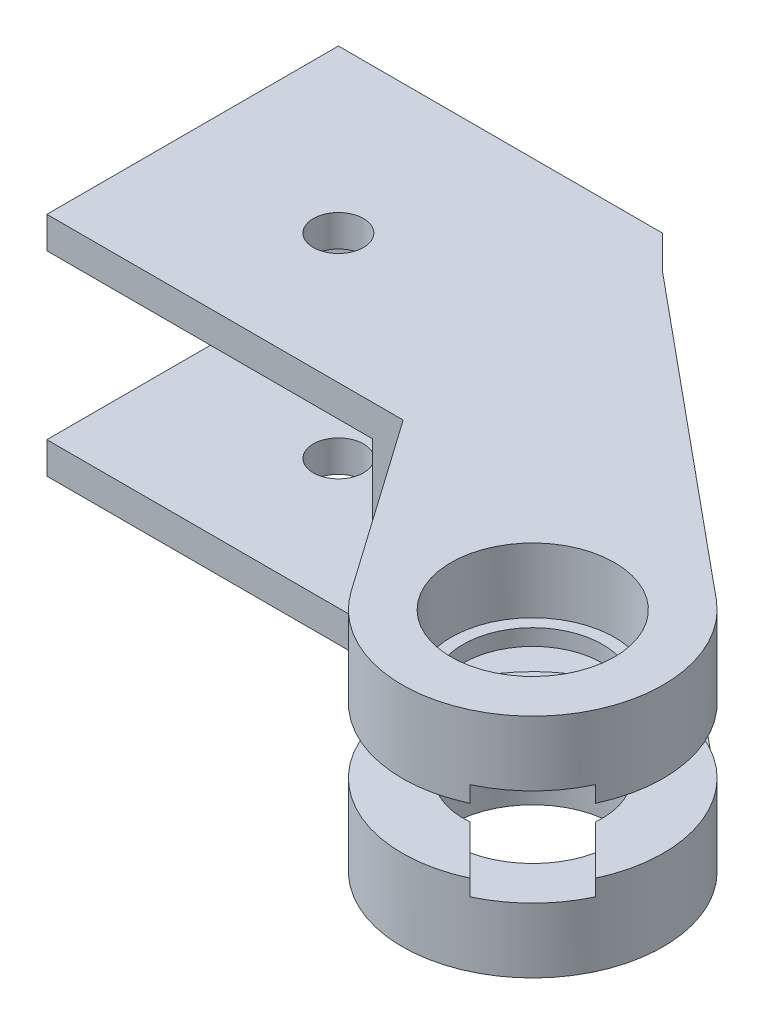
from build123d import *
from build123d.topology import SkipClean

# Parameters (mm, degrees)
SKETCH1_W           = 12
SKETCH1_H           = 16
BOSS_EXTRUDE1_DEPTH = 7
SKETCH4_W           = 16
SKETCH4_H           = 10.1
CUT_EXTRUDE1_DEPTH  = 10.1
SKETCH5_R           = 5.05
BOSS_EXTRUDE2_DEPTH = 4
BOSS_EXTRUDE3_DEPTH = 1
BOSS_EXTRUDE5_DEPTH = 6
SKETCH9_W           = 16
SKETCH9_H           = 1.95
BOSS_EXTRUDE6_DEPTH = 10
SKETCH10_W          = 22
SKETCH10_H          = 14
BOSS_EXTRUDE7_DEPTH = 2
CUT_EXTRUDE2_START  = -14
SKETCH7_R           = 1.55
CUT_EXTRUDE2_DEPTH  = 14
CHAMFER1_SIZE       = 2
SKETCH11_W          = 20.1
SKETCH11_H          = 10.1
CUT_EXTRUDE3_DEPTH  = 0.1


with BuildPart() as part:
    # Sketch1 → Boss-Extrude1 (new, symmetric)
    with BuildSketch(Plane(origin=(0, 0, 0), x_dir=(1, 0, 0), z_dir=(0, 1, 0))):
        with Locations((-6, 0)):
            Rectangle(SKETCH1_W, SKETCH1_H)
    extrude(amount=BOSS_EXTRUDE1_DEPTH, both=True)

    # Sketch4 → Cut-Extrude1 (cut)
    with BuildSketch(Plane.ZY.offset(12)):
        Rectangle(SKETCH4_W, SKETCH4_H)
    extrude(amount=-CUT_EXTRUDE1_DEPTH, mode=Mode.SUBTRACT)

    # Sketch5 → Boss-Extrude2 (add)
    with BuildSketch(Plane.XZ.offset(7)):
        with BuildLine():
            Line((0, 8), (7.55203, 18.76523))
            ThreePointArc((7.55203, 18.76523), (19.604366, 20.055387), (19.272474, 7.938739))
            Line((19.272474, 7.938739), (0, -8))
            Line((0, -8), (0, 8))
        make_face()
        with Locations(Location((14.142136, 14.142136, 0), (0, 0, 270))):
            Circle(SKETCH5_R, mode=Mode.SUBTRACT)
    boss_extrude2 = extrude(amount=-BOSS_EXTRUDE2_DEPTH)

    # Mirror1: Boss-Extrude2 across plane
    add(boss_extrude2.mirror(Plane(origin=(0, 0, 0), x_dir=(0, 0, 1), z_dir=(0, -1, 0))))

    # Sketch6 → Boss-Extrude3 (add)
    with SkipClean():  # the faces are left unmerged after this step: merging them gives an invalid solid
        with BuildSketch(Plane(origin=(0, -3, 0), x_dir=(1, 0, 0), z_dir=(0, 1, 0))):
            with BuildLine():
                Line((14.535059, -18.424146), (17.547358, -21.436446))
                ThreePointArc((17.547358, -21.436446), (8.449926, -8.449926), (21.436446, -17.547358))
                Line((21.436446, -17.547358), (18.424146, -14.535059))
                ThreePointArc((18.424146, -14.535059), (11.101576, -11.101576), (14.535059, -18.424146))
            make_face()
        boss_extrude3 = extrude(amount=BOSS_EXTRUDE3_DEPTH)

    # Mirror2: Boss-Extrude3 across plane
    with SkipClean():  # the faces are left unmerged after this step: merging them gives an invalid solid
        add(boss_extrude3.mirror(Plane(origin=(0, 0, 0), x_dir=(0, 0, 1), z_dir=(0, -1, 0))))

    # Sketch8 → Boss-Extrude5 (add)
    with SkipClean():  # the faces are left unmerged after this step: merging them gives an invalid solid
        with BuildSketch(Plane.XZ.offset(-3)):
            Polygon((13.107608, 2.840266), (0, -8), (0, 8), align=None)
        extrude(amount=BOSS_EXTRUDE5_DEPTH)

    # Sketch9 → Boss-Extrude6 (add)
    with SkipClean():  # the faces are left unmerged after this step: merging them gives an invalid solid
        with BuildSketch(Plane.ZY.offset(12)):
            with Locations((0, 6.025)):
                Rectangle(SKETCH9_W, SKETCH9_H)
            with Locations((0, -6.025)):
                Rectangle(SKETCH9_W, SKETCH9_H)
        extrude(amount=BOSS_EXTRUDE6_DEPTH)

    # Sketch10 → Boss-Extrude7 (add)
    with SkipClean():  # the faces are left unmerged after this step: merging them gives an invalid solid
        with BuildSketch(Plane(origin=(0, 0, -8), x_dir=(-1, 0, 0), z_dir=(0, 0, -1))):
            with Locations((11, 0)):
                Rectangle(SKETCH10_W, SKETCH10_H)
        extrude(amount=BOSS_EXTRUDE7_DEPTH)

    # Sketch7 → Cut-Extrude2 (cut)
    with SkipClean():  # the faces are left unmerged after this step: merging them gives an invalid solid
        with BuildSketch(Plane(origin=(0, 7, 0), x_dir=(1, 0, 0), z_dir=(0, 1, 0)).offset(CUT_EXTRUDE2_START)):
            with Locations(Location((-12, 0, 0), (0, 0, 270))):
                Circle(SKETCH7_R)
        extrude(amount=CUT_EXTRUDE2_DEPTH, mode=Mode.SUBTRACT)

    # Chamfer1
    chamfer1_edges = [part.edges().sort_by_distance(p)[0] for p in [
        (0, 0, -10),
    ]]
    chamfer(chamfer1_edges, length=CHAMFER1_SIZE - 0.0001)  # a hair under: the kernel refuses the full size

    # Sketch11 → Cut-Extrude3 (cut)
    with BuildSketch(Plane.XY.offset(-8)):
        with Locations((-11.95, 0)):
            Rectangle(SKETCH11_W, SKETCH11_H)
    extrude(amount=-CUT_EXTRUDE3_DEPTH, mode=Mode.SUBTRACT)


solid = part.part
